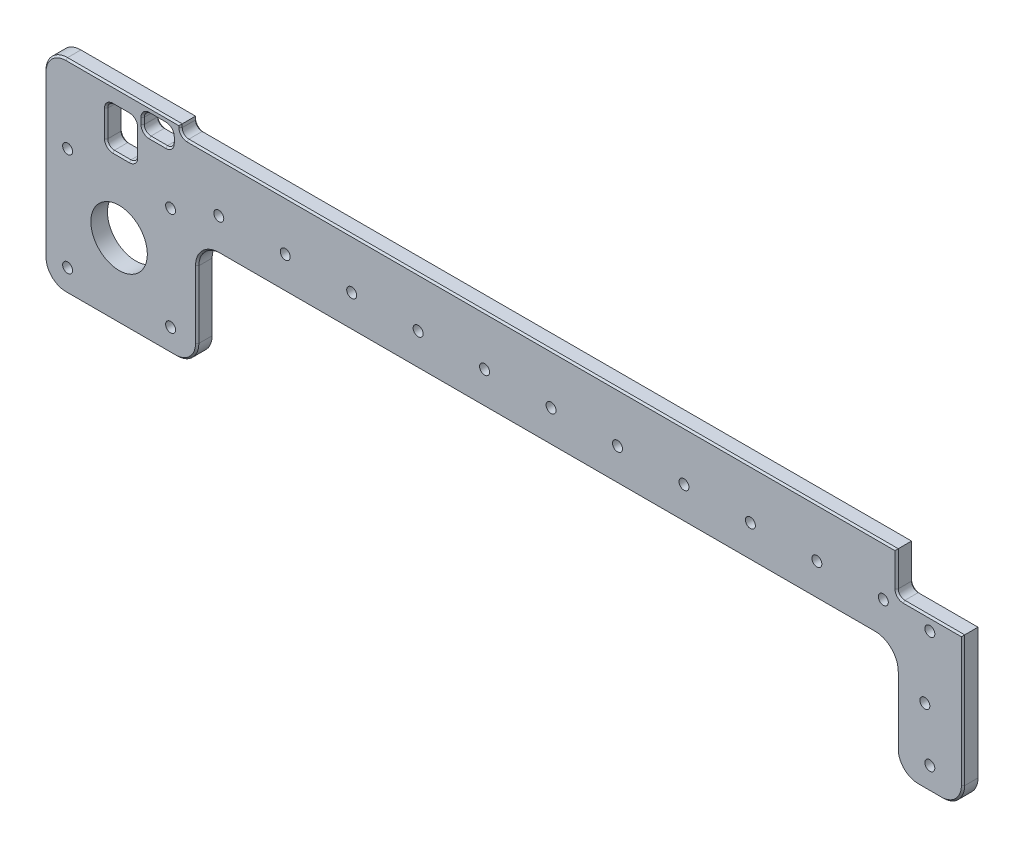
from build123d import *

# Parameters (mm, degrees)
SKETCH1_R           = 1.5
SKETCH1_R_2         = 8.5
BOSS_EXTRUDE1_DEPTH = 5
CHAMFER1_SIZE       = 0.5


with BuildPart() as part:
    # Sketch1 → Boss-Extrude1 (new body)
    with BuildSketch(Plane.XY):
        with BuildLine():
            Line((0, -10), (197.5, -10))
            ThreePointArc((197.5, -10), (202.096194078, -11.903805922), (204, -16.5))
            Line((204, -16.5), (204, -36.746197724))
            ThreePointArc((204, -36.746197724), (205.903805922, -41.342391801), (210.5, -43.246197724))
            Line((210.5, -43.246197724), (217.5, -43.246197724))
            ThreePointArc((217.5, -43.246197724), (222.096194078, -41.342391801), (224, -36.746197724))
            Line((224, -36.746197724), (224, 2.55))
            Line((224, 2.55), (206, 2.55))
            ThreePointArc((206, 2.55), (204.585786438, 3.135786438), (204, 4.55))
            Line((204, 4.55), (204, 15))
            Line((204, 15), (-9.5, 15))
            ThreePointArc((-9.5, 15), (-10.914213562, 15.585786438), (-11.5, 17))
            Line((-11.5, 17), (-11.5, 18))
            Line((-11.5, 18), (-46, 18))
            ThreePointArc((-46, 18), (-50.596194078, 16.096194078), (-52.5, 11.5))
            Line((-52.5, 11.5), (-52.5, -36.746197724))
            ThreePointArc((-52.5, -36.746197724), (-50.596194078, -41.342391801), (-46, -43.246197724))
            Line((-46, -43.246197724), (-13, -43.246197724))
            ThreePointArc((-13, -43.246197724), (-8.403805922, -41.342391801), (-6.5, -36.746197724))
            Line((-6.5, -36.746197724), (-6.5, -16.5))
            ThreePointArc((-6.5, -16.5), (-4.596194078, -11.903805922), (0, -10))
        make_face()
        Circle(SKETCH1_R, mode=Mode.SUBTRACT)
        with Locations((20, 0)):
            Circle(SKETCH1_R, mode=Mode.SUBTRACT)
        with Locations((40, 0)):
            Circle(SKETCH1_R, mode=Mode.SUBTRACT)
        with Locations((60, 0)):
            Circle(SKETCH1_R, mode=Mode.SUBTRACT)
        with Locations((80, 0)):
            Circle(SKETCH1_R, mode=Mode.SUBTRACT)
        with Locations((100, 0)):
            Circle(SKETCH1_R, mode=Mode.SUBTRACT)
        with Locations((120, 0)):
            Circle(SKETCH1_R, mode=Mode.SUBTRACT)
        with Locations((140, 0)):
            Circle(SKETCH1_R, mode=Mode.SUBTRACT)
        with Locations((160, 0)):
            Circle(SKETCH1_R, mode=Mode.SUBTRACT)
        with Locations((180, 0)):
            Circle(SKETCH1_R, mode=Mode.SUBTRACT)
        with Locations((-30, -20.746197724)):
            Circle(SKETCH1_R_2, mode=Mode.SUBTRACT)
        with Locations((-45.5, -5.246197724)):
            Circle(SKETCH1_R, mode=Mode.SUBTRACT)
        with Locations((-14.5, -5.246197724)):
            Circle(SKETCH1_R, mode=Mode.SUBTRACT)
        with Locations((-45.5, -36.246197724)):
            Circle(SKETCH1_R, mode=Mode.SUBTRACT)
        with Locations((-14.5, -36.246197724)):
            Circle(SKETCH1_R, mode=Mode.SUBTRACT)
        with Locations((200, 0)):
            Circle(SKETCH1_R, mode=Mode.SUBTRACT)
        with Locations((212.5, -20.746197724)):
            Circle(SKETCH1_R, mode=Mode.SUBTRACT)
        with Locations((214, -36.246197724)):
            Circle(SKETCH1_R, mode=Mode.SUBTRACT)
        with Locations((214, -1.246197724)):
            Circle(SKETCH1_R, mode=Mode.SUBTRACT)
        with BuildLine():
            Line((-20.9, 16), (-15.9, 16))
            ThreePointArc((-15.9, 16), (-14.485786438, 15.414213562), (-13.9, 14))
            Line((-13.9, 14), (-13.9, 12.12))
            ThreePointArc((-13.9, 12.12), (-14.485786438, 10.705786438), (-15.9, 10.12))
            Line((-15.9, 10.12), (-20.9, 10.12))
            ThreePointArc((-20.9, 10.12), (-22.314213562, 10.705786438), (-22.9, 12.12))
            Line((-22.9, 12.12), (-22.9, 14))
            ThreePointArc((-22.9, 14), (-22.314213562, 15.414213562), (-20.9, 16))
        make_face(mode=Mode.SUBTRACT)
        with BuildLine():
            Line((-26.9, 12.9), (-31.9, 12.9))
            ThreePointArc((-31.9, 12.9), (-33.314213562, 12.314213562), (-33.9, 10.9))
            Line((-33.9, 10.9), (-33.9, 2.9))
            ThreePointArc((-33.9, 2.9), (-33.314213562, 1.485786438), (-31.9, 0.9))
            Line((-31.9, 0.9), (-26.9, 0.9))
            ThreePointArc((-26.9, 0.9), (-25.485786438, 1.485786438), (-24.9, 2.9))
            Line((-24.9, 2.9), (-24.9, 10.9))
            ThreePointArc((-24.9, 10.9), (-25.485786438, 12.314213562), (-26.9, 12.9))
        make_face(mode=Mode.SUBTRACT)
    extrude(amount=BOSS_EXTRUDE1_DEPTH)

    # Chamfer1
    chamfer1_edges = [part.edges().sort_by_distance(p)[0] for p in [
        (98.75, -10, 0),
        (-4.596194078, -11.903805922, 0),
        (-6.5, -26.623098862, 0),
        (-8.403805922, -41.342391801, 0),
        (-29.5, -43.246197724, 0),
        (-52.5, -12.623098862, 0),
        (98.75, -10, 5),
        (-4.596194078, -11.903805922, 5),
        (-6.5, -26.623098862, 5),
        (-8.403805922, -41.342391801, 5),
        (-29.5, -43.246197724, 5),
        (-52.5, -12.623098862, 5),
        (224, -17.098098862, 0),
        (222.096194078, -41.342391801, 0),
        (214, -43.246197724, 0),
        (205.903805922, -41.342391801, 0),
        (204, -26.623098862, 0),
        (202.096194078, -11.903805922, 0),
        (224, -17.098098862, 5),
        (222.096194078, -41.342391801, 5),
        (214, -43.246197724, 5),
        (205.903805922, -41.342391801, 5),
        (204, -26.623098862, 5),
        (202.096194078, -11.903805922, 5),
        (-28.75, 18, 0),
        (-28.75, 18, 5),
        (-50.596194078, 16.096194078, 0),
        (-50.596194078, 16.096194078, 5),
        (-11.5, 17.5, 0),
        (97.25, 15, 0),
        (-11.5, 17.5, 5),
        (97.25, 15, 5),
        (-18.4, 16, 5),
        (-22.314213562, 15.414213562, 5),
        (-14.485786438, 15.414213562, 5),
        (-22.9, 13.06, 5),
        (-13.9, 13.06, 5),
        (-22.314213562, 10.705786438, 5),
        (-14.485786438, 10.705786438, 5),
        (-18.4, 10.12, 5),
        (-18.4, 16, 0),
        (-22.314213562, 15.414213562, 0),
        (-14.485786438, 15.414213562, 0),
        (-22.9, 13.06, 0),
        (-13.9, 13.06, 0),
        (-22.314213562, 10.705786438, 0),
        (-14.485786438, 10.705786438, 0),
        (-18.4, 10.12, 0),
        (-50.596194078, -41.342391801, 0),
        (-50.596194078, -41.342391801, 5),
        (-10.914213562, 15.585786438, 0),
        (-10.914213562, 15.585786438, 5),
        (204, 9.775, 5),
        (204.585786438, 3.135786438, 5),
        (215, 2.55, 5),
        (215, 2.55, 0),
        (204.585786438, 3.135786438, 0),
        (204, 9.775, 0),
        (-29.4, 12.9, 0),
        (-33.314213562, 12.314213562, 0),
        (-25.485786438, 12.314213562, 0),
        (-33.9, 6.9, 0),
        (-24.9, 6.9, 0),
        (-33.314213562, 1.485786438, 0),
        (-25.485786438, 1.485786438, 0),
        (-29.4, 0.9, 0),
        (-29.4, 12.9, 5),
        (-33.314213562, 12.314213562, 5),
        (-25.485786438, 12.314213562, 5),
        (-33.9, 6.9, 5),
        (-24.9, 6.9, 5),
        (-33.314213562, 1.485786438, 5),
        (-25.485786438, 1.485786438, 5),
        (-29.4, 0.9, 5),
    ]]
    chamfer(chamfer1_edges, length=CHAMFER1_SIZE)


solid = part.part
